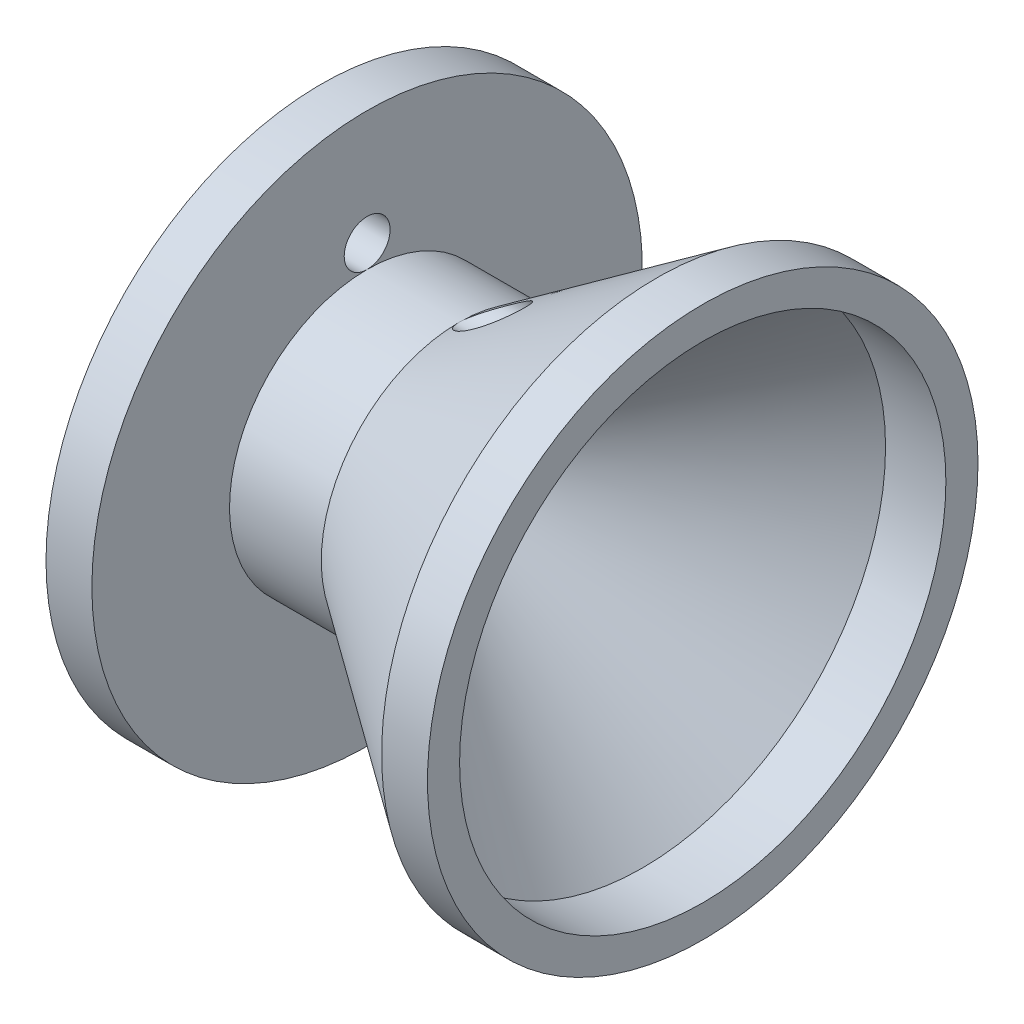
from build123d import *

# Parameters (mm, degrees)
SKETCH_1_R          = 6
EXTRUDE_1_DEPTH     = 10
SKETCH_7_R          = 12
EXTRUDE_2_DEPTH     = 2
EXTRUDE_START       = 2
SKETCH_8_R          = 12
EXTRUDE_3_DEPTH     = 2
SKETCH_9_R          = 2.6
CUT_EXTRUDE_4_DEPTH = 22
FILLET_3_R          = 0.4
SKETCH_10_R         = 1
CUT_EXTRUDE_5_DEPTH = 50
CHAMFER_1_SIZE      = 6
CHAMFER_2_SIZE      = 8
SKETCH_15_R         = 12
SKETCH_15_R_2       = 10.6
EXTRUDE_5_DEPTH     = 2.63


with BuildPart() as part:
    # 草图1 → 凸台-拉伸1 (new body)
    with BuildSketch(Plane(origin=(0, 0, 0), x_dir=(0, 0, -1), z_dir=(1, 0, 0))):
        with Locations((-12, 12)):
            Circle(SKETCH_1_R)
    extrude(amount=EXTRUDE_1_DEPTH)

    # 草图7 → 凸台-拉伸2 (add)
    with BuildSketch(Plane(origin=(10, 0, 0), x_dir=(0, 0, -1), z_dir=(1, 0, 0))):
        with Locations((-12, 12)):
            Circle(SKETCH_7_R)
    extrude(amount=EXTRUDE_2_DEPTH)

    # 草图8 → 凸台-拉伸3 (add)
    with BuildSketch(Plane.ZY.offset(EXTRUDE_START)):
        with Locations(Location((12, 12, 0), (0, 0, 180))):
            Circle(SKETCH_8_R)
    extrude(amount=-EXTRUDE_3_DEPTH)

    # 草图9 → 切除-拉伸4 (cut)
    with BuildSketch(Plane.ZY.offset(2)):
        with Locations((12, 12)):
            Circle(SKETCH_9_R)
    extrude(amount=-CUT_EXTRUDE_4_DEPTH, mode=Mode.SUBTRACT)

    # 圆角3
    fillet_3_edges = [part.edges().sort_by_distance(p)[0] for p in [
        (-2, 12, 9.4),
    ]]
    fillet(fillet_3_edges, radius=FILLET_3_R)

    # 草图10 → 切除-拉伸5 (cut)
    with BuildSketch(Plane.ZY.offset(2)):
        with Locations((12, 19)):
            Circle(SKETCH_10_R)
    extrude(amount=-CUT_EXTRUDE_5_DEPTH, mode=Mode.SUBTRACT)

    # 倒角1
    # the kernel refuses this chamfer: 6 mm, written as the material it adds along each edge
    with BuildSketch(Plane(origin=(10, 12, 12), x_dir=(0, 1, 0), z_dir=(0, 0, -1))) as chamfer_1_piece_1_section:
        Polygon((6, -CHAMFER_1_SIZE), (6 + CHAMFER_1_SIZE, 0), (6, 0), align=None)
    chamfer_1_piece_1 = revolve(axis=Axis((10, 12, 12), (1, 0, 0)), revolution_arc=270, mode=Mode.PRIVATE)
    chamfer_1_piece_1 = chamfer_1_piece_1 - Plane(origin=(7.061897577, 19, 12), x_dir=(0, 0, 1), z_dir=(-1, 0, 0)) * Cylinder(1, 49, mode=Mode.PRIVATE)
    add(chamfer_1_piece_1)
    with BuildSketch(Plane(origin=(10, 12, 12), x_dir=(0, 0, -1), z_dir=(0, -1, 0))) as chamfer_1_piece_2_section:
        Polygon((6, -CHAMFER_1_SIZE), (6 + CHAMFER_1_SIZE, 0), (6, 0), align=None)
    chamfer_1_piece_2 = revolve(axis=Axis((10, 12, 12), (1, 0, 0)), revolution_arc=90, mode=Mode.PRIVATE)
    chamfer_1_piece_2 = chamfer_1_piece_2 - Plane(origin=(8.14797738, 19, 12), x_dir=(0, 0, 1), z_dir=(-1, 0, 0)) * Cylinder(1, 48, mode=Mode.PRIVATE)
    add(chamfer_1_piece_2)

    # 倒角2
    # the kernel refuses this chamfer: 8 mm, written as the material it takes off along each edge
    with BuildSketch(Plane(origin=(12, 12, 12), x_dir=(0, 0, 1), z_dir=(0, -1, 0))) as chamfer_2_piece_1:
        Polygon((2.6 + CHAMFER_2_SIZE, 0), (2.6, CHAMFER_2_SIZE), (2.6, 0), align=None)
    revolve(axis=Axis((12, 12, 12), (-1, 0, 0)), mode=Mode.SUBTRACT)

    # 草图15 → 凸台-拉伸5 (add)
    with BuildSketch(Plane(origin=(12, 0, 0), x_dir=(0, 0, -1), z_dir=(1, 0, 0))):
        with Locations((-12, 12)):
            Circle(SKETCH_15_R)
        with Locations((-12, 12)):
            Circle(SKETCH_15_R_2, mode=Mode.SUBTRACT)
    extrude(amount=EXTRUDE_5_DEPTH)

    # 草图18 → 切除-旋转1 (revolve, cut)
    with BuildSketch(Plane.XY.offset(12), mode=Mode.PRIVATE) as cut_revolve_1_sk:
        Polygon((12.63, 24), (4, 18), (4, 24), align=None)
    revolve(cut_revolve_1_sk.sketch.rotate(Axis((10, 12, 12), (-1, 0, 0)), 90), axis=Axis((10, 12, 12), (-1, 0, 0)), mode=Mode.SUBTRACT)


solid = part.part
